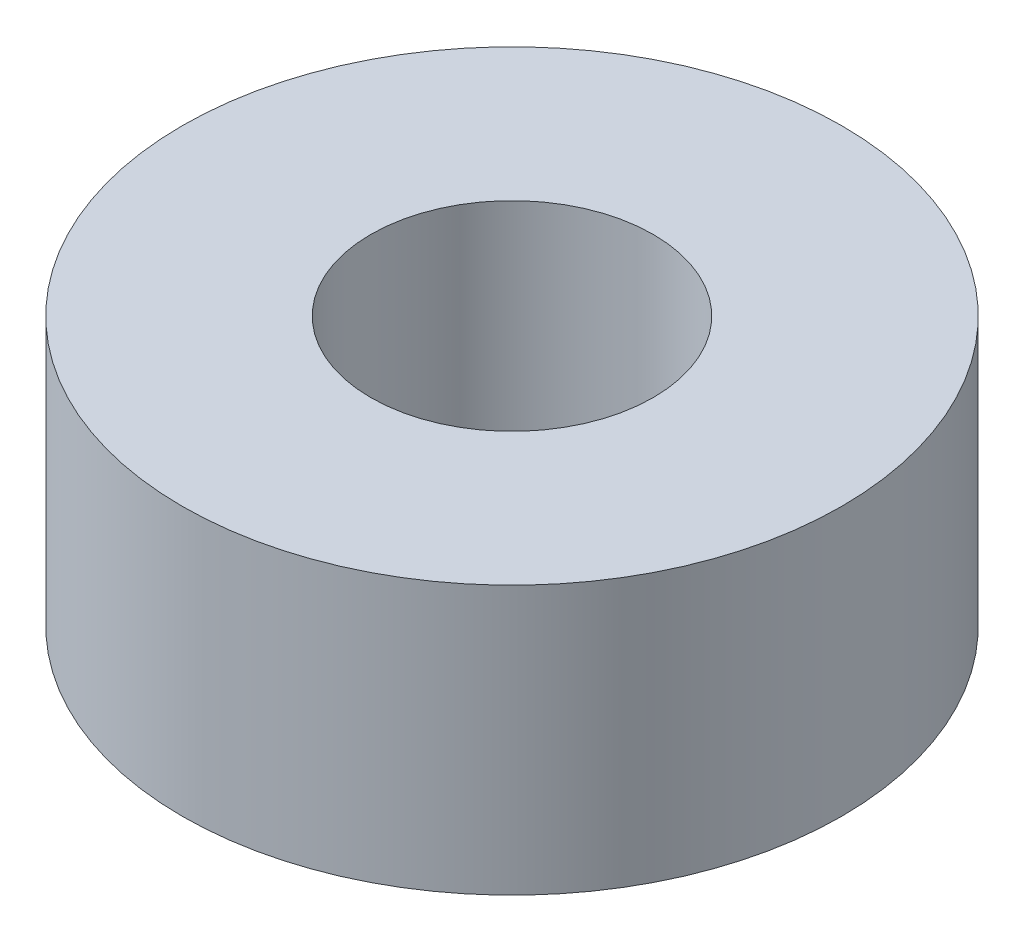
from build123d import *

# Parameters (mm, degrees)
SKETCH_1_R      = 7
SKETCH_1_R_2    = 3
EXTRUDE_1_DEPTH = 5.7


with BuildPart() as part:
    # 草图1 → 凸台-拉伸1 (new body)
    with BuildSketch(Plane(origin=(0, 0, 0), x_dir=(1, 0, 0), z_dir=(0, 1, 0))):
        Circle(SKETCH_1_R)
        Circle(SKETCH_1_R_2, mode=Mode.SUBTRACT)
    extrude(amount=EXTRUDE_1_DEPTH)


solid = part.part
